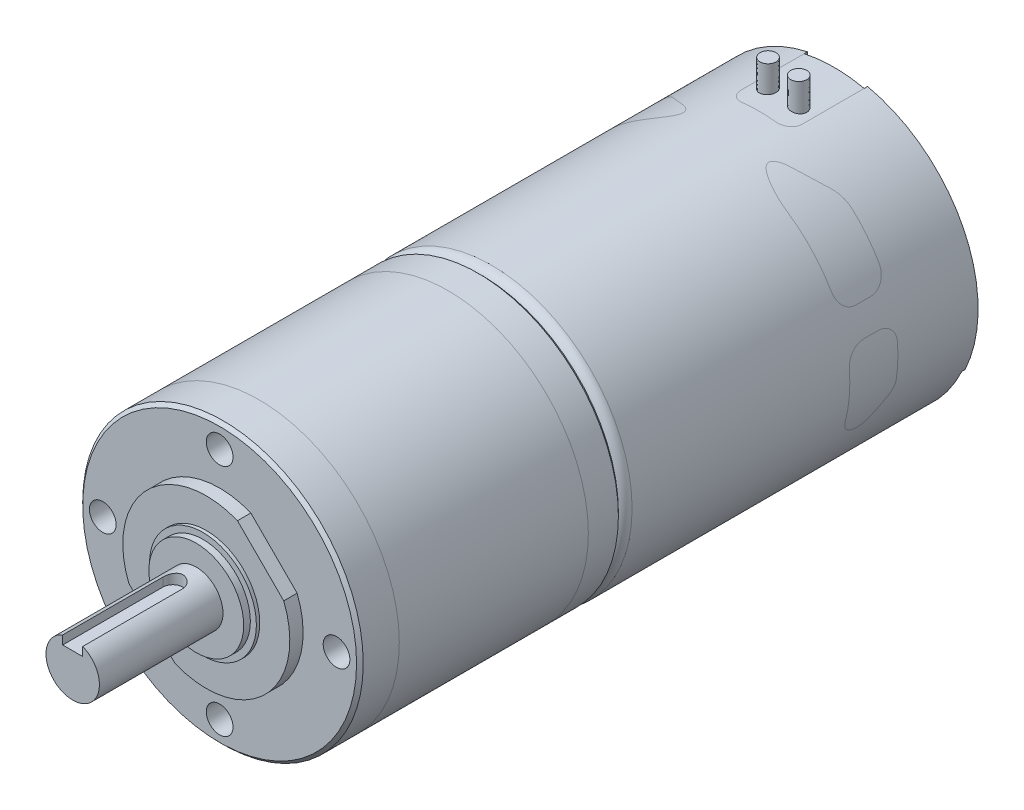
from build123d import *

# Parameters (mm, degrees)
SKETCH_1_R          = 21.05
EXTRUDE_1_DEPTH     = 53.3
FILLET_1_R          = 1.5
CUT_EXTRUDE_1_DEPTH = 0.5
SKETCH_3_R          = 7.5
EXTRUDE_2_DEPTH     = 4.2
SKETCH_4_R          = 6.5
CUT_EXTRUDE_2_DEPTH = 1
SKETCH_5_R          = 2.5
EXTRUDE_3_DEPTH     = 1.3
FILLET_2_R          = 0.75
FILLET_3_R          = 2.5
FILLET_4_R          = 0.5
SKETCH_7_W          = 9
SKETCH_7_H          = 4.55
CUT_EXTRUDE_3_DEPTH = 0.5
SKETCH_9_R          = 21
EXTRUDE_4_DEPTH     = 39.2
EXTRUDE_5_DEPTH     = 2
SKETCH_11_R         = 8
EXTRUDE_6_DEPTH     = 0.5
SKETCH_12_R         = 7.1
EXTRUDE_7_DEPTH     = 1
SKETCH_13_R         = 4
EXTRUDE_8_DEPTH     = 20
CUT_EXTRUDE_4_DEPTH = 1.6
SKETCH_15_R         = 2
CUT_EXTRUDE_5_DEPTH = 6
CHAMFER_1_SIZE      = 0.5
EXTRUDE_9_DEPTH     = 25


with BuildPart() as part:
    # ｽｹｯﾁ1 → ﾎﾞｽ - 押し出し1 (new body)
    with BuildSketch(Plane.XY):
        Circle(SKETCH_1_R)
    extrude(amount=EXTRUDE_1_DEPTH)

    # ﾌｨﾚｯﾄ1
    fillet_1_edges = [part.edges().sort_by_distance(p)[0] for p in [
        (-21.05, 0, 53.3),
    ]]
    fillet(fillet_1_edges, radius=FILLET_1_R)

    # ｽｹｯﾁ2 → ｶｯﾄ - 押し出し1 (cut)
    with BuildSketch(Plane(origin=(0, 0, 0), x_dir=(-1, 0, 0), z_dir=(0, 0, -1))):
        with BuildLine():
            Line((-1.767766953, -10.606601718), (-8.902744604, -17.741579369))
            ThreePointArc((-8.902744604, -17.741579369), (0, -19.85), (8.902744604, -17.741579369))
            Line((8.902744604, -17.741579369), (1.767766953, -10.606601718))
            ThreePointArc((1.767766953, -10.606601718), (0, -9.874368671), (-1.767766953, -10.606601718))
        make_face()
        with BuildLine():
            Line((-17.741579369, -8.902744604), (-9.939267924, -1.100433159))
            ThreePointArc((-9.939267924, -1.100433159), (-8.682968675, 4.960449072), (-4.1, 9.120855223))
            Line((-4.1, 9.120855223), (-4.1, 19.421959221))
            ThreePointArc((-4.1, 19.421959221), (-17.883955352, 8.613166721), (-17.741579369, -8.902744604))
        make_face()
        with BuildLine():
            Line((4.1, 19.421959221), (4.1, 9.120855223))
            ThreePointArc((4.1, 9.120855223), (8.682968675, 4.960449072), (9.939267924, -1.100433159))
            Line((9.939267924, -1.100433159), (17.741579369, -8.902744604))
            ThreePointArc((17.741579369, -8.902744604), (17.883955352, 8.613166721), (4.1, 19.421959221))
        make_face()
    extrude(amount=-CUT_EXTRUDE_1_DEPTH, mode=Mode.SUBTRACT)

    # ｽｹｯﾁ3 → ﾎﾞｽ - 押し出し2 (add)
    with BuildSketch(Plane(origin=(0, 0, 0), x_dir=(-1, 0, 0), z_dir=(0, 0, -1))):
        with Locations(Location((0, 0, 0), (0, 0, 180))):
            Circle(SKETCH_3_R)
    extrude(amount=EXTRUDE_2_DEPTH)

    # ｽｹｯﾁ4 → ｶｯﾄ - 押し出し2 (cut)
    with BuildSketch(Plane(origin=(0, 0, -4.2), x_dir=(-1, 0, 0), z_dir=(0, 0, -1))):
        Circle(SKETCH_4_R)
    extrude(amount=-CUT_EXTRUDE_2_DEPTH, mode=Mode.SUBTRACT)

    # ｽｹｯﾁ5 → ﾎﾞｽ - 押し出し3 (add)
    with BuildSketch(Plane(origin=(0, 0, -3.2), x_dir=(-1, 0, 0), z_dir=(0, 0, -1))):
        Circle(SKETCH_5_R)
    extrude(amount=EXTRUDE_3_DEPTH)

    # ﾌｨﾚｯﾄ2
    fillet_2_edges = [part.edges().sort_by_distance(p)[0] for p in [
        (2.5, 0, -4.5),
    ]]
    fillet(fillet_2_edges, radius=FILLET_2_R)

    # ﾌｨﾚｯﾄ3
    fillet_3_edges = [part.edges().sort_by_distance(p)[0] for p in [
        (-9.939267924, -1.100433159, 0.25),
        (-4.1, 9.120855223, 0.25),
        (4.1, 9.120855223, 0.25),
        (9.939267924, -1.100433159, 0.25),
    ]]
    fillet(fillet_3_edges, radius=FILLET_3_R)

    # ﾌｨﾚｯﾄ4
    fillet_4_edges = [part.edges().sort_by_distance(p)[0] for p in [
        (5.335255779, -14.174090543, 0),
        (-5.335255779, -14.174090543, 0),
        (-14.236593669, -5.397758904, 0),
        (-10.184921124, -1.070153656, 0),
        (-8.764891514, 4.814216109, 0),
        (-4.414822662, 9.401058845, 0),
        (14.236593669, -5.397758904, 0),
        (10.184921124, -1.070153656, 0),
        (8.764891514, 4.814216109, 0),
        (4.414822662, 9.401058845, 0),
        (0, -9.874368671, 0),
        (-4.1, 15.018756923, 0),
        (4.1, 15.018756923, 0),
    ]]
    fillet(fillet_4_edges, radius=FILLET_4_R - 0.0001)  # a hair under: the kernel refuses the full size

    # ｽｹｯﾁ7 → ｶｯﾄ - 押し出し3 (cut)
    with BuildSketch(Plane(origin=(0, 0, 0), x_dir=(-1, 0, 0), z_dir=(0, 0, -1))):
        with Locations((0, 18.775)):
            Rectangle(SKETCH_7_W, SKETCH_7_H)
        Polygon((-6.257895014, -16.510943341), (-9.75807358, -20.011121908), (-20.011121908, -9.75807358), (-16.510943341, -6.257895014), align=None)
        Polygon((6.257895014, -16.510943341), (16.510943341, -6.257895014), (20.011121908, -9.75807358), (9.75807358, -20.011121908), align=None)
    extrude(amount=-CUT_EXTRUDE_3_DEPTH, mode=Mode.SUBTRACT)

    # ｽｹｯﾁ9 → ﾎﾞｽ - 押し出し4 (add)
    with BuildSketch(Plane.XY.offset(53.3)):
        Circle(SKETCH_9_R)
    extrude(amount=EXTRUDE_4_DEPTH)

    # ｽｹｯﾁ10 → ﾎﾞｽ - 押し出し5 (add)
    with BuildSketch(Plane.XY.offset(92.5)):
        with BuildLine():
            Line((4.667626369, 11.595829599), (11.595829599, 4.667626369))
            ThreePointArc((11.595829599, 4.667626369), (8.838834765, -8.838834765), (-4.667626369, -11.595829599))
            Line((-4.667626369, -11.595829599), (-11.595829599, -4.667626369))
            ThreePointArc((-11.595829599, -4.667626369), (-8.838834765, 8.838834765), (4.667626369, 11.595829599))
        make_face()
    extrude(amount=EXTRUDE_5_DEPTH)

    # ｽｹｯﾁ11 → ﾎﾞｽ - 押し出し6 (add)
    with BuildSketch(Plane.XY.offset(94.5)):
        Circle(SKETCH_11_R)
    extrude(amount=EXTRUDE_6_DEPTH)

    # ｽｹｯﾁ12 → ﾎﾞｽ - 押し出し7 (add)
    with BuildSketch(Plane.XY.offset(95)):
        Circle(SKETCH_12_R)
    extrude(amount=EXTRUDE_7_DEPTH)

    # ｽｹｯﾁ13 → ﾎﾞｽ - 押し出し8 (add)
    with BuildSketch(Plane.XY.offset(94.5)):
        Circle(SKETCH_13_R)
    extrude(amount=EXTRUDE_8_DEPTH)

    # ｽｹｯﾁ14 → ｶｯﾄ - 押し出し4 (cut)
    with BuildSketch(Plane(origin=(0, 4, 0), x_dir=(1, 0, 0), z_dir=(0, 1, 0))):
        with BuildLine():
            Line((-1.5, -114.5), (-1.5, -99.5))
            ThreePointArc((-1.5, -99.5), (0, -98), (1.5, -99.5))
            Line((1.5, -99.5), (1.5, -114.5))
            ThreePointArc((1.5, -114.5), (0, -116), (-1.5, -114.5))
        make_face()
    extrude(amount=-CUT_EXTRUDE_4_DEPTH, mode=Mode.SUBTRACT)

    # ｽｹｯﾁ15 → ｶｯﾄ - 押し出し5 (cut)
    with BuildSketch(Plane.XY.offset(92.5)):
        with Locations((0, 17.5)):
            Circle(SKETCH_15_R)
        with Locations((17.5, 0)):
            Circle(SKETCH_15_R)
        with Locations((0, -17.5)):
            Circle(SKETCH_15_R)
        with Locations((-17.5, 0)):
            Circle(SKETCH_15_R)
    extrude(amount=-CUT_EXTRUDE_5_DEPTH, mode=Mode.SUBTRACT)

    # 面取り1
    chamfer_1_edges = [part.edges().sort_by_distance(p)[0] for p in [
        (-21, 0, 53.3),
        (-21, 0, 92.5),
    ]]
    chamfer(chamfer_1_edges, length=CHAMFER_1_SIZE)

    # ｽｹｯﾁ19 → ﾎﾞｽ - 押し出し9 (add)
    with BuildSketch(Plane(origin=(0, 0, 0), x_dir=(1, 0, 0), z_dir=(0, 1, 0))):
        with BuildLine():
            add(Edge.make_bspline(
                [(-2.3, -9.3), (-2.141895722, -9.3), (-1.984582336, -9.26831111), (-1.695786007, -9.148505891), (-1.561830045, -9.059042657), (-1.339916148, -8.83681524), (-1.250815241, -8.703488676), (-1.130324814, -8.411202826), (-1.099488051, -8.254725269), (-1.100524759, -7.937433107), (-1.132539642, -7.780879651), (-1.254416503, -7.490445543), (-1.344667636, -7.357097524), (-1.567516387, -7.136655943), (-1.702165246, -7.047850886), (-1.991590037, -6.92982589), (-2.149326122, -6.899295567), (-2.461692814, -6.900729728), (-2.617940839, -6.932319306), (-2.907178904, -7.053148359), (-3.038602416, -7.141124571), (-3.26167511, -7.365046532), (-3.349599592, -7.497417785), (-3.469481665, -7.788427754), (-3.500435327, -7.946423907), (-3.499555239, -8.260305399), (-3.467445926, -8.418673048), (-3.34669763, -8.707376797), (-3.256905259, -8.840768765), (-3.035347061, -9.061077904), (-2.902667973, -9.149452405), (-2.612947139, -9.269026571), (-2.458104278, -9.3), (-2.3, -9.3)],
                knots=[0, 0, 0, 0, 0.0625, 0.0625, 0.125, 0.125, 0.1875, 0.1875, 0.25, 0.25, 0.3125, 0.3125, 0.375, 0.375, 0.4375, 0.4375, 0.5, 0.5, 0.5625, 0.5625, 0.625, 0.625, 0.6875, 0.6875, 0.75, 0.75, 0.8125, 0.8125, 0.875, 0.875, 0.9375, 0.9375, 1, 1, 1, 1], degree=3))
        make_face()
        with BuildLine():
            add(Edge.make_bspline(
                [(2.3, -9.3), (2.458101824, -9.3), (2.615002003, -9.268333612), (2.902663727, -9.149297919), (3.036114818, -9.060490649), (3.257502016, -8.83999811), (3.346925979, -8.707290324), (3.468262095, -8.416258156), (3.499849023, -8.259893759), (3.500149899, -7.94238048), (3.468784785, -7.78588338), (3.348388342, -7.495343893), (3.259144479, -7.362166602), (3.038513671, -7.141379213), (2.905239906, -7.052187197), (2.617888296, -6.932449554), (2.460768356, -6.900612609), (2.148510682, -6.899405329), (1.991426227, -6.92973338), (1.700237772, -7.048797353), (1.567538038, -7.136292434), (1.342020343, -7.360062317), (1.253313742, -7.492276634), (1.131817712, -7.783408851), (1.100245068, -7.941102293), (1.09975782, -8.255174381), (1.131152757, -8.41364744), (1.250962434, -8.703405981), (1.340590257, -8.837664202), (1.562488668, -9.059527262), (1.695817167, -9.148670082), (1.986527204, -9.268965629), (2.141898176, -9.3), (2.3, -9.3)],
                knots=[0, 0, 0, 0, 0.0625, 0.0625, 0.125, 0.125, 0.1875, 0.1875, 0.25, 0.25, 0.3125, 0.3125, 0.375, 0.375, 0.4375, 0.4375, 0.5, 0.5, 0.5625, 0.5625, 0.625, 0.625, 0.6875, 0.6875, 0.75, 0.75, 0.8125, 0.8125, 0.875, 0.875, 0.9375, 0.9375, 1, 1, 1, 1], degree=3))
        make_face()
    extrude(amount=EXTRUDE_9_DEPTH)


solid = part.part
